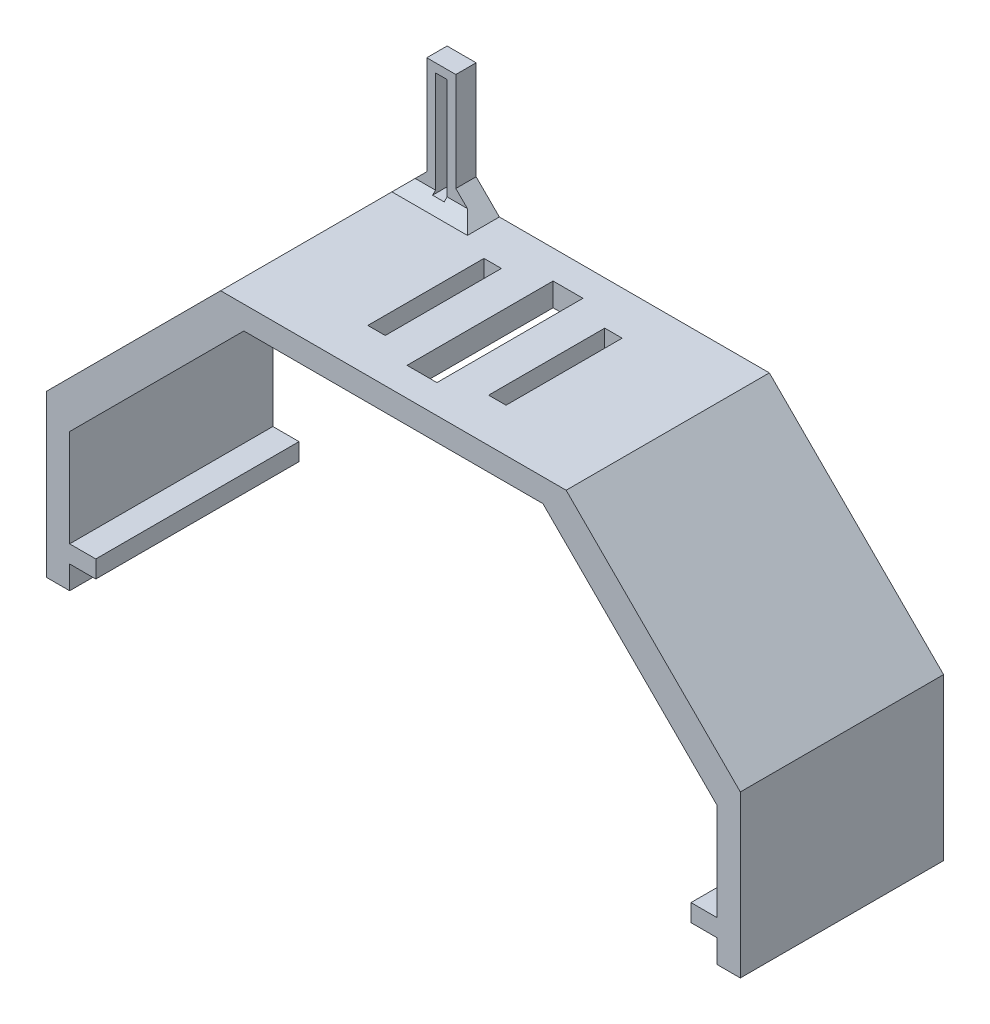
from build123d import *

# Parameters (mm, degrees)
BOSS_EXTRUDE1_DEPTH = 17.5
CHAMFER1_SIZE       = 30
SKETCH6_W           = 5.15
SKETCH6_H           = 25.15
CUT_EXTRUDE2_DEPTH  = 4
SKETCH7_W           = 3
SKETCH7_H           = 20
CUT_EXTRUDE3_DEPTH  = 10
SKETCH8_W           = 5
SKETCH8_H           = 25
SKETCH8_W_2         = 2
SKETCH8_H_2         = 18
BOSS_EXTRUDE2_DEPTH = 3.5
CHAMFER2_SIZE       = 4
CHAMFER3_SIZE       = 2


# Some blends are built 0.0001 mm under size
with BuildPart() as part:
    # Sketch1 → Boss-Extrude1 (new, symmetric)
    with BuildSketch(Plane.XY):
        Polygon((55.75, -26.875), (55.75, -22.875), (51.25, -22.875), (51.25, -19.875), (55.75, -19.875), (55.75, 26.875), (-55.75, 26.875), (-55.75, -19.875), (-51.25, -19.875), (-51.25, -22.875), (-55.75, -22.875), (-55.75, -26.875), (-59.75, -26.875), (-59.75, 30.875), (59.75, 30.875), (59.75, -26.875), align=None)
    extrude(amount=BOSS_EXTRUDE1_DEPTH, both=True)

    # Chamfer1
    chamfer1_edges = [part.edges().sort_by_distance(p)[0] for p in [
        (-59.75, 30.875, 0),
        (59.75, 30.875, 0),
        (55.75, 26.875, 0),
        (-55.75, 26.875, 0),
    ]]
    chamfer(chamfer1_edges, length=CHAMFER1_SIZE)

    # Sketch6 → Cut-Extrude2 (cut)
    with BuildSketch(Plane(origin=(0, 30.875, 0), x_dir=(1, 0, 0), z_dir=(0, 1, 0))):
        Rectangle(SKETCH6_W, SKETCH6_H)
    extrude(amount=-CUT_EXTRUDE2_DEPTH, mode=Mode.SUBTRACT)

    # Sketch7 → Cut-Extrude3 (cut)
    with BuildSketch(Plane(origin=(0, 30.875, 0), x_dir=(1, 0, 0), z_dir=(0, 1, 0))):
        with Locations((10.4, 0)):
            Rectangle(SKETCH7_W, SKETCH7_H)
        with Locations((-10.4, 0)):
            Rectangle(SKETCH7_W, SKETCH7_H)
    extrude(amount=-CUT_EXTRUDE3_DEPTH, mode=Mode.SUBTRACT)

    # Sketch8 → Boss-Extrude2 (add)
    with BuildSketch(Plane.XY.offset(-17.5)):
        with Locations((-23.25, 39.375)):
            Rectangle(SKETCH8_W, SKETCH8_H)
        with Locations((-23.25, 41.375)):
            Rectangle(SKETCH8_W_2, SKETCH8_H_2, mode=Mode.SUBTRACT)
    extrude(amount=BOSS_EXTRUDE2_DEPTH)

    # Chamfer2
    chamfer2_edges = [part.edges().sort_by_distance(p)[0] for p in [
        (-20.75, 30.875, -15.75),
        (-25.75, 30.875, -15.75),
    ]]
    chamfer(chamfer2_edges, length=CHAMFER2_SIZE - 0.0001)  # a hair under: the kernel refuses the full size

    # Chamfer3
    # the kernel refuses this chamfer: 2 mm, written as the material it adds along each edge
    with BuildSketch(Plane(origin=(-11.606734024, 30.875, -14), x_dir=(0, 0.9996219169112968, -0.02749587661058651), z_dir=(-1, 0, 0))) as chamfer3_piece_1_section:
        Polygon((CHAMFER3_SIZE * 0.999621916911, -CHAMFER3_SIZE * 0.0274958766106), (-CHAMFER3_SIZE * 0.0274958766106, -CHAMFER3_SIZE * 0.999621916911), (0, 0), align=None)
    chamfer3_piece_1 = extrude(amount=23.286531952, mode=Mode.PRIVATE)
    chamfer3_piece_1 = split(chamfer3_piece_1, bisect_by=Plane(origin=(-22.25, 32.567452132, -13.881504022), z_dir=(1, 0, 0)), keep=Keep.TOP, mode=Mode.PRIVATE)
    chamfer3_piece_1 = split(chamfer3_piece_1, bisect_by=Plane(origin=(-19.394414099, 33.519314099, -13.881504022), z_dir=(-0.7071067811865476, -0.7071067811865476, 0)), keep=Keep.TOP, mode=Mode.PRIVATE)
    chamfer3_piece_1 = split(chamfer3_piece_1, bisect_by=Plane(origin=(-20.346276066, 32.375, -13.881504022), z_dir=(0, 1, 0)), keep=Keep.TOP, mode=Mode.PRIVATE)
    add(chamfer3_piece_1)
    with BuildSketch(Plane(origin=(-11.606734024, 30.875, -14), x_dir=(0, 0.9996219169112968, -0.02749587661058651), z_dir=(-1, 0, 0))) as chamfer3_piece_2_section:
        Polygon((CHAMFER3_SIZE * 0.999621916911, -CHAMFER3_SIZE * 0.0274958766106), (-CHAMFER3_SIZE * 0.0274958766106, -CHAMFER3_SIZE * 0.999621916911), (0, 0), align=None)
    chamfer3_piece_2 = extrude(amount=23.286531952, mode=Mode.PRIVATE)
    chamfer3_piece_2 = split(chamfer3_piece_2, bisect_by=Plane(origin=(-22.25, 31.41379866, -13.276536182), z_dir=(1, 0, 0)), keep=Keep.TOP, mode=Mode.PRIVATE)
    chamfer3_piece_2 = split(chamfer3_piece_2, bisect_by=Plane(origin=(-18.529173995, 32.654073995, -13.276536182), z_dir=(-0.7071067811865476, -0.7071067811865476, 0)), keep=Keep.TOP, mode=Mode.PRIVATE)
    chamfer3_piece_2 = split(chamfer3_piece_2, bisect_by=Plane(origin=(-19.76944933, 32.375, -13.276536182), z_dir=(0, -1, 0)), keep=Keep.TOP, mode=Mode.PRIVATE)
    add(chamfer3_piece_2)
    with BuildSketch(Plane(origin=(-11.606734024, 30.875, -14), x_dir=(0, 0.9996219169112968, -0.02749587661058651), z_dir=(-1, 0, 0))) as chamfer3_piece_3_section:
        Polygon((CHAMFER3_SIZE * 0.999621916911, -CHAMFER3_SIZE * 0.0274958766106), (-CHAMFER3_SIZE * 0.0274958766106, -CHAMFER3_SIZE * 0.999621916911), (0, 0), align=None)
    chamfer3_piece_3 = extrude(amount=23.286531952, mode=Mode.PRIVATE)
    chamfer3_piece_3 = split(chamfer3_piece_3, bisect_by=Plane(origin=(-22.25, 31.449972825, -13.29608178), z_dir=(-1, 0, 0)), keep=Keep.TOP, mode=Mode.PRIVATE)
    chamfer3_piece_3 = split(chamfer3_piece_3, bisect_by=Plane(origin=(-23.25, 32.375, -13.29608178), z_dir=(0, -1, 0)), keep=Keep.TOP, mode=Mode.PRIVATE)
    chamfer3_piece_3 = split(chamfer3_piece_3, bisect_by=Plane(origin=(-24.25, 31.449972825, -13.29608178), z_dir=(1, 0, 0)), keep=Keep.TOP, mode=Mode.PRIVATE)
    add(chamfer3_piece_3)
    with BuildSketch(Plane(origin=(-11.606734024, 30.875, -14), x_dir=(0, 0.9996219169112968, -0.02749587661058651), z_dir=(-1, 0, 0))) as chamfer3_piece_4_section:
        Polygon((CHAMFER3_SIZE * 0.999621916911, -CHAMFER3_SIZE * 0.0274958766106), (-CHAMFER3_SIZE * 0.0274958766106, -CHAMFER3_SIZE * 0.999621916911), (0, 0), align=None)
    chamfer3_piece_4 = extrude(amount=23.286531952, mode=Mode.PRIVATE)
    chamfer3_piece_4 = split(chamfer3_piece_4, bisect_by=Plane(origin=(-27.105585901, 33.519314099, -13.881504022), z_dir=(0.7071067811865472, -0.7071067811865478, 0)), keep=Keep.TOP, mode=Mode.PRIVATE)
    chamfer3_piece_4 = split(chamfer3_piece_4, bisect_by=Plane(origin=(-26.153723934, 32.375, -13.881504022), z_dir=(0, 1, 0)), keep=Keep.TOP, mode=Mode.PRIVATE)
    chamfer3_piece_4 = split(chamfer3_piece_4, bisect_by=Plane(origin=(-24.25, 32.567452132, -13.881504022), z_dir=(-1, 0, 0)), keep=Keep.TOP, mode=Mode.PRIVATE)
    add(chamfer3_piece_4)
    with BuildSketch(Plane(origin=(-11.606734024, 30.875, -14), x_dir=(0, 0.9996219169112968, -0.02749587661058651), z_dir=(-1, 0, 0))) as chamfer3_piece_5_section:
        Polygon((CHAMFER3_SIZE * 0.999621916911, -CHAMFER3_SIZE * 0.0274958766106), (-CHAMFER3_SIZE * 0.0274958766106, -CHAMFER3_SIZE * 0.999621916911), (0, 0), align=None)
    chamfer3_piece_5 = extrude(amount=23.286531952, mode=Mode.PRIVATE)
    chamfer3_piece_5 = split(chamfer3_piece_5, bisect_by=Plane(origin=(-27.970826005, 32.654073995, -13.276536182), z_dir=(0.7071067811865472, -0.7071067811865478, 0)), keep=Keep.TOP, mode=Mode.PRIVATE)
    chamfer3_piece_5 = split(chamfer3_piece_5, bisect_by=Plane(origin=(-26.73055067, 32.375, -13.276536182), z_dir=(0, -1, 0)), keep=Keep.TOP, mode=Mode.PRIVATE)
    chamfer3_piece_5 = split(chamfer3_piece_5, bisect_by=Plane(origin=(-24.25, 31.41379866, -13.276536182), z_dir=(-1, 0, 0)), keep=Keep.TOP, mode=Mode.PRIVATE)
    add(chamfer3_piece_5)


solid = part.part
